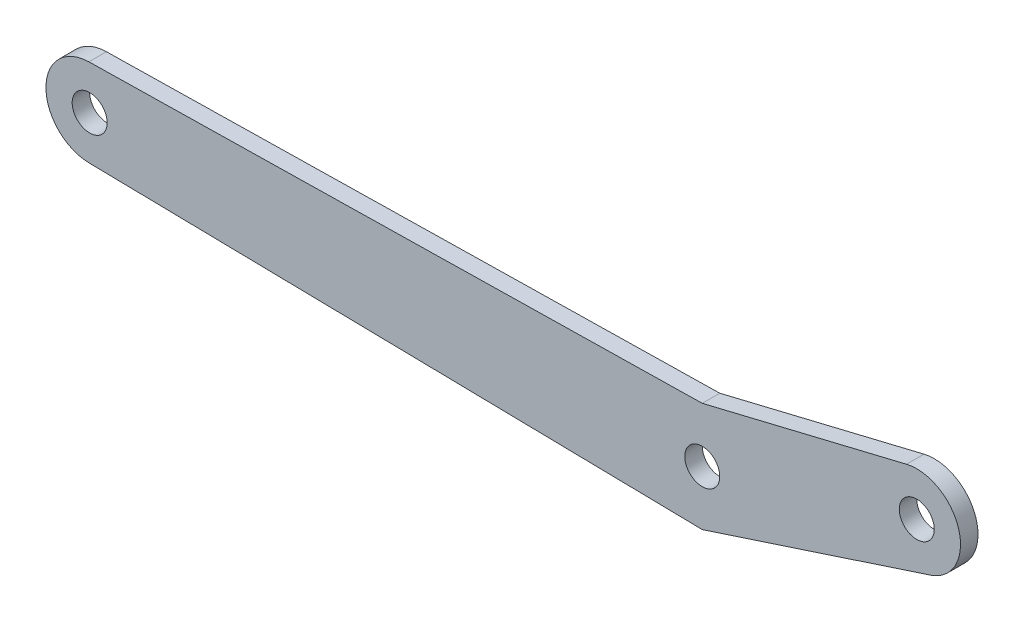
from build123d import *

# Parameters (mm, degrees)
CROQUIS1_R              = 4
SALIENTE_EXTRUIR1_DEPTH = 4


with BuildPart() as part:
    # Croquis1 → Saliente-Extruir1 (new body)
    with BuildSketch(Plane.XY):
        with BuildLine():
            Line((-140.178429288, 9.998408023), (0, 12.5))
            Line((0, 12.5), (46.675729797, 23.777793189))
            ThreePointArc((46.675729797, 23.777793189), (58.644226539, 16.788422189), (52.133297226, 4.553062746))
            Line((52.133297226, 4.553062746), (0, -12.5))
            Line((0, -12.5), (-140.178429288, -9.998408023))
            ThreePointArc((-140.178429288, -9.998408023), (-150, 0), (-140.178429288, 9.998408023))
        make_face()
        Circle(CROQUIS1_R, mode=Mode.SUBTRACT)
        with Locations((49.024346493, 14.057505147)):
            Circle(CROQUIS1_R, mode=Mode.SUBTRACT)
        with Locations((-140, 0)):
            Circle(CROQUIS1_R, mode=Mode.SUBTRACT)
    extrude(amount=SALIENTE_EXTRUIR1_DEPTH)


solid = part.part
